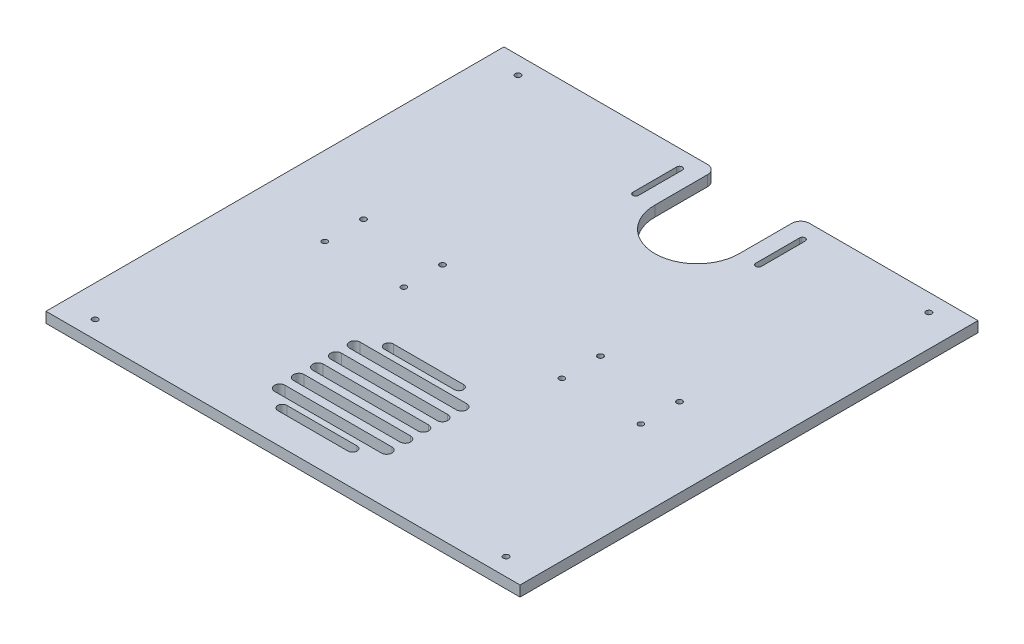
from build123d import *

# Parameters (mm, degrees)
SKETCH1_R               = 1.6
BOSS_EXTRUDE1_DEPTH     = 6
CUT_EXTRUDE1_DEPTH      = 203.20197823
CUT_EXTRUDE1_DEPTH_BACK = 203.20197823
SKETCH4_R               = 1.6
CUT_EXTRUDE2_DEPTH      = 10
CUT_EXTRUDE3_DEPTH      = 10
FILLET1_R               = 5
CUT_EXTRUDE4_DEPTH      = 10
CUT_EXTRUDE4_DEPTH_BACK = 10
SKETCH7_R               = 1.55
CUT_EXTRUDE5_DEPTH      = 10


with BuildPart() as part:
    # Sketch1 → Boss-Extrude1 (new body)
    with BuildSketch(Plane(origin=(0, 0, 0), x_dir=(1, 0, 0), z_dir=(0, 1, 0))):
        Polygon((-145, 120), (125, 120), (125, -100.8), (125, -140.8), (-145, -140.8), (-145, -100.8), align=None)
        with Locations((-100, -5)):
            Circle(SKETCH1_R, mode=Mode.SUBTRACT)
        with Locations((80, -5)):
            Circle(SKETCH1_R, mode=Mode.SUBTRACT)
        with Locations((-55, -5)):
            Circle(SKETCH1_R, mode=Mode.SUBTRACT)
        with Locations((35, -5)):
            Circle(SKETCH1_R, mode=Mode.SUBTRACT)
    extrude(amount=BOSS_EXTRUDE1_DEPTH)

    # Sketch3 → Cut-Extrude1 (cut, two sides: drawn at the far end of the back side and taken through both)
    with BuildSketch(Plane(origin=(0, 6, 0), x_dir=(1, 0, 0), z_dir=(0, 1, 0)).offset(-CUT_EXTRUDE1_DEPTH_BACK)):
        with BuildLine():
            Line((-24, 85), (-24, 120))
            Line((-24, 120), (24, 120))
            Line((24, 120), (24, 85))
            ThreePointArc((24, 85), (0, 61), (-24, 85))
        make_face()
    extrude(amount=CUT_EXTRUDE1_DEPTH + CUT_EXTRUDE1_DEPTH_BACK, mode=Mode.SUBTRACT)

    # Sketch4 → Cut-Extrude2 (cut)
    with BuildSketch(Plane.XZ):
        with Locations((107, -110)):
            Circle(SKETCH4_R)
        with Locations((-127, -110)):
            Circle(SKETCH4_R)
        with Locations((107, 130.8)):
            Circle(SKETCH4_R)
        with Locations((-127, 130.8)):
            Circle(SKETCH4_R)
    extrude(amount=-CUT_EXTRUDE2_DEPTH, mode=Mode.SUBTRACT)

    # Sketch5 → Cut-Extrude3 (cut)
    with BuildSketch(Plane(origin=(0, 6, 0), x_dir=(1, 0, 0), z_dir=(0, 1, 0))):
        with BuildLine():
            Line((-33.4, 110), (-33.4, 85))
            ThreePointArc((-33.4, 85), (-35, 83.4), (-36.6, 85))
            Line((-36.6, 85), (-36.6, 110))
            ThreePointArc((-36.6, 110), (-35, 111.6), (-33.4, 110))
        make_face()
        with BuildLine():
            Line((33.4, 110), (33.4, 85))
            ThreePointArc((33.4, 85), (35, 83.4), (36.6, 85))
            Line((36.6, 85), (36.6, 110))
            ThreePointArc((36.6, 110), (35, 111.6), (33.4, 110))
        make_face()
    extrude(amount=-CUT_EXTRUDE3_DEPTH, mode=Mode.SUBTRACT)

    # Fillet1
    fillet1_edges = [part.edges().sort_by_distance(p)[0] for p in [
        (24, 3, -120),
        (-24, 3, -120),
    ]]
    fillet(fillet1_edges, radius=FILLET1_R)

    # Sketch6 → Cut-Extrude4 (cut, two sides: drawn at the far end of the back side and taken through both)
    with BuildSketch(Plane.XZ.offset(-CUT_EXTRUDE4_DEPTH_BACK)):
        with BuildLine():
            Line((10, 58.021465569), (-30, 58.021465569))
            ThreePointArc((-30, 58.021465569), (-32.570860459, 60.592326028), (-30, 63.163186487))
            Line((-30, 63.163186487), (10, 63.163186487))
            ThreePointArc((10, 63.163186487), (12.570860459, 60.592326028), (10, 58.021465569))
        make_face()
        with BuildLine():
            Line((20.436008981, 66.571059525), (-40.436008981, 66.571059525))
            ThreePointArc((-40.436008981, 66.571059525), (-43.436008981, 69.571059525), (-40.436008981, 72.571059525))
            Line((-40.436008981, 72.571059525), (20.436008981, 72.571059525))
            ThreePointArc((20.436008981, 72.571059525), (23.436008981, 69.571059525), (20.436008981, 66.571059525))
        make_face()
        with BuildLine():
            Line((20.316760433, 77.325947728), (-40.316760433, 77.325947728))
            ThreePointArc((-40.316760433, 77.325947728), (-43.316760433, 80.325947728), (-40.316760433, 83.325947728))
            Line((-40.316760433, 83.325947728), (20.316760433, 83.325947728))
            ThreePointArc((20.316760433, 83.325947728), (23.316760433, 80.325947728), (20.316760433, 77.325947728))
        make_face()
        with BuildLine():
            Line((-30, 123.777281933), (10, 123.777281933))
            ThreePointArc((10, 123.777281933), (12.570860459, 121.206421475), (10, 118.635561016))
            Line((10, 118.635561016), (-30, 118.635561016))
            ThreePointArc((-30, 118.635561016), (-32.570860459, 121.206421475), (-30, 123.777281933))
        make_face()
        with BuildLine():
            Line((-40.436008981, 115.227687978), (20.436008981, 115.227687978))
            ThreePointArc((20.436008981, 115.227687978), (23.436008981, 112.227687978), (20.436008981, 109.227687978))
            Line((20.436008981, 109.227687978), (-40.436008981, 109.227687978))
            ThreePointArc((-40.436008981, 109.227687978), (-43.436008981, 112.227687978), (-40.436008981, 115.227687978))
        make_face()
        with BuildLine():
            Line((-40.316760433, 104.472799775), (20.316760433, 104.472799775))
            ThreePointArc((20.316760433, 104.472799775), (23.316760433, 101.472799775), (20.316760433, 98.472799775))
            Line((20.316760433, 98.472799775), (-40.316760433, 98.472799775))
            ThreePointArc((-40.316760433, 98.472799775), (-43.316760433, 101.472799775), (-40.316760433, 104.472799775))
        make_face()
        with BuildLine():
            Line((20, 87.899373751), (-40, 87.899373751))
            ThreePointArc((-40, 87.899373751), (-43, 90.899373751), (-40, 93.899373751))
            Line((-40, 93.899373751), (20, 93.899373751))
            ThreePointArc((20, 93.899373751), (23, 90.899373751), (20, 87.899373751))
        make_face()
    extrude(amount=CUT_EXTRUDE4_DEPTH + CUT_EXTRUDE4_DEPTH_BACK, mode=Mode.SUBTRACT)

    # Sketch7 → Cut-Extrude5 (cut)
    with BuildSketch(Plane.XZ):
        with Locations((80, 27)):
            Circle(SKETCH7_R)
        with Locations((35, 27)):
            Circle(SKETCH7_R)
        with Locations((-55, 27)):
            Circle(SKETCH7_R)
        with Locations((-100, 27)):
            Circle(SKETCH7_R)
    extrude(amount=-CUT_EXTRUDE5_DEPTH, mode=Mode.SUBTRACT)


solid = part.part
